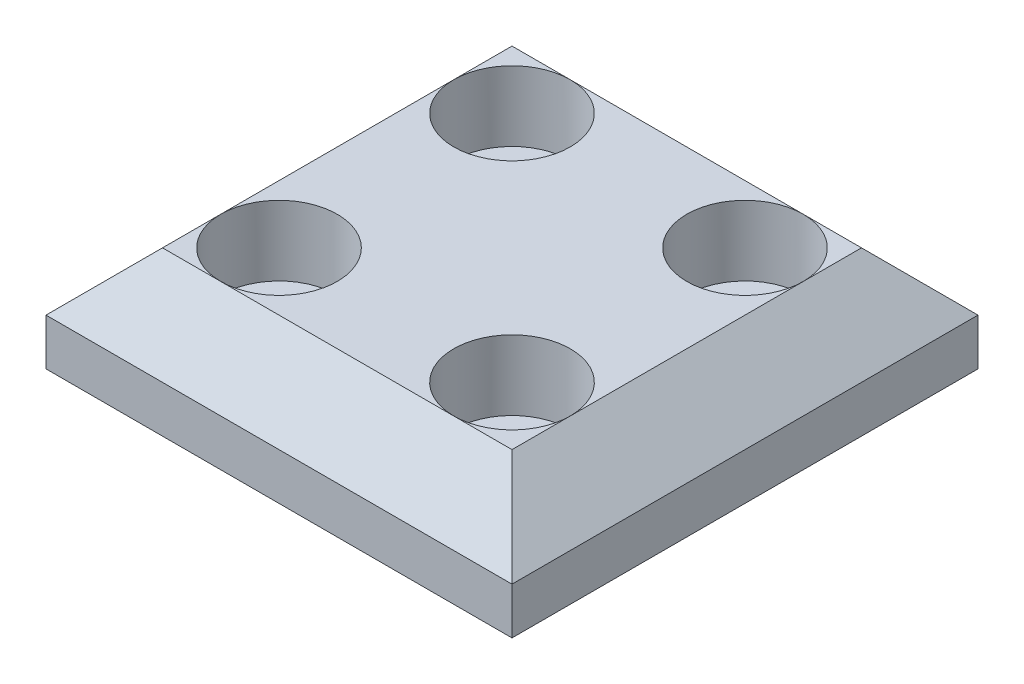
from build123d import *

# Parameters (mm, degrees)
SKETCH1_W           = 40
SKETCH1_H           = 40
SKETCH1_R           = 2.75
BOSS_EXTRUDE1_DEPTH = 9
SKETCH2_R           = 5
CUT_EXTRUDE1_DEPTH  = 6
CHAMFER1_SIZE       = 5


with BuildPart() as part:
    # Sketch1 → Boss-Extrude1 (new body)
    with BuildSketch(Plane(origin=(0, 0, 0), x_dir=(1, 0, 0), z_dir=(0, 1, 0))):
        with Locations((20, 20)):
            Rectangle(SKETCH1_W, SKETCH1_H)
        with Locations(Location((10, 30, 0), (0, 0, 270))):
            Circle(SKETCH1_R, mode=Mode.SUBTRACT)
        with Locations(Location((30, 30, 0), (0, 0, 270))):
            Circle(SKETCH1_R, mode=Mode.SUBTRACT)
        with Locations(Location((30, 10, 0), (0, 0, 270))):
            Circle(SKETCH1_R, mode=Mode.SUBTRACT)
        with Locations(Location((10, 10, 0), (0, 0, 270))):
            Circle(SKETCH1_R, mode=Mode.SUBTRACT)
    extrude(amount=BOSS_EXTRUDE1_DEPTH)

    # Sketch2 → Cut-Extrude1 (cut)
    with BuildSketch(Plane(origin=(0, 9, 0), x_dir=(1, 0, 0), z_dir=(0, 1, 0))):
        with Locations(Location((10, 10, 0), (0, 0, 270))):
            Circle(SKETCH2_R)
        with Locations(Location((30, 10, 0), (0, 0, 270))):
            Circle(SKETCH2_R)
        with Locations(Location((30, 30, 0), (0, 0, 270))):
            Circle(SKETCH2_R)
        with Locations(Location((10, 30, 0), (0, 0, 270))):
            Circle(SKETCH2_R)
    extrude(amount=-CUT_EXTRUDE1_DEPTH, mode=Mode.SUBTRACT)

    # Chamfer1
    chamfer1_edges = [part.edges().sort_by_distance(p)[0] for p in [
        (40, 9, -20),
        (20, 9, -40),
        (0, 9, -20),
        (20, 9, 0),
    ]]
    chamfer(chamfer1_edges, length=CHAMFER1_SIZE - 0.0001)  # a hair under: the kernel refuses the full size


solid = part.part
